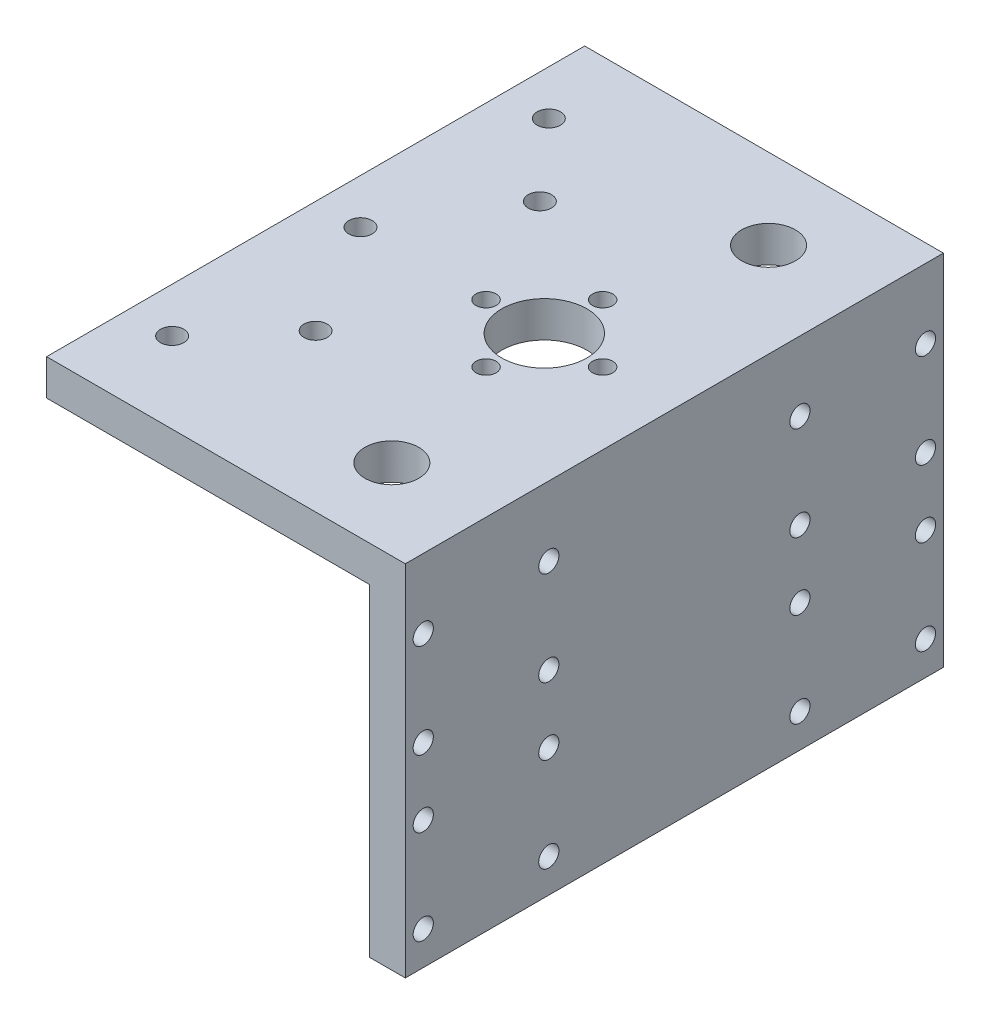
from build123d import *

# Parameters (mm, degrees)
ESTRUSIONE_ESTRUSIONE1_DEPTH = 120
TAGLIO_ESTRUSIONE2_REACH     = 166.924
SCHIZZO6_R                   = 6
TAGLIO_ESTRUSIONE3_REACH     = 166.924
SCHIZZO7_R                   = 9.5
FORO_PER_VITE_M4_2_D         = 4.5
SCHIZZO12_R                  = 2.25
TAGLIO_ESTRUSIONE4_DEPTH     = 10
SCHIZZO14_R                  = 2.6
TAGLIO_ESTRUSIONE5_DEPTH     = 10


with BuildPart() as part:
    # Schizzo1 → Estrusione-Estrusione1 (new body)
    with BuildSketch(Plane.XY):
        Polygon((0, 0), (-80, 0), (-80, -8), (-8, -8), (-8, -80), (0, -80), align=None)
    extrude(amount=ESTRUSIONE_ESTRUSIONE1_DEPTH)

    # Schizzo6 → Taglio-Estrusione2 (cut, up to next)
    with BuildSketch(Plane(origin=(0, 0, 0), x_dir=(1, 0, 0), z_dir=(0, 1, 0)), mode=Mode.PRIVATE) as taglio_estrusione2_sk1:
        with Locations((-21, -18)):
            Circle(SCHIZZO6_R)
    taglio_estrusione2_tool1 = extrude(taglio_estrusione2_sk1.sketch, amount=-TAGLIO_ESTRUSIONE2_REACH, mode=Mode.PRIVATE) & part.part
    # Schizzo6 → Taglio-Estrusione2 (cut, up to next)
    with BuildSketch(Plane(origin=(0, 0, 0), x_dir=(1, 0, 0), z_dir=(0, 1, 0)), mode=Mode.PRIVATE) as taglio_estrusione2_sk2:
        with Locations((-21, -102)):
            Circle(SCHIZZO6_R)
    taglio_estrusione2_tool2 = extrude(taglio_estrusione2_sk2.sketch, amount=-TAGLIO_ESTRUSIONE2_REACH, mode=Mode.PRIVATE) & part.part
    add(taglio_estrusione2_tool1.solids().sort_by_distance((-21, 0, 18))[0], mode=Mode.SUBTRACT)
    add(taglio_estrusione2_tool2.solids().sort_by_distance((-21, 0, 102))[0], mode=Mode.SUBTRACT)

    # Schizzo7 → Taglio-Estrusione3 (cut, up to next)
    with BuildSketch(Plane(origin=(0, 0, 0), x_dir=(1, 0, 0), z_dir=(0, 1, 0)), mode=Mode.PRIVATE) as taglio_estrusione3_sk1:
        with Locations((-29, -60)):
            Circle(SCHIZZO7_R)
    taglio_estrusione3_tool1 = extrude(taglio_estrusione3_sk1.sketch, amount=-TAGLIO_ESTRUSIONE3_REACH, mode=Mode.PRIVATE) & part.part
    add(taglio_estrusione3_tool1.solids().sort_by_distance((-29, 0, 60))[0], mode=Mode.SUBTRACT)

    # Foro per Vite M4-2 (through all)
    with Locations(Plane(origin=(0, 0, 0), x_dir=(1, 0, 0), z_dir=(0, 1, 0))):
        with Locations((-29, -47), (-42, -60), (-29, -73), (-16, -60), (-29, -60)):
            Hole(FORO_PER_VITE_M4_2_D / 2)

    # Schizzo12 → Taglio-Estrusione4 (cut)
    with BuildSketch(Plane(origin=(0, 0, 0), x_dir=(0, 0, -1), z_dir=(1, 0, 0))):
        with Locations((-116, -15.5)):
            Circle(SCHIZZO12_R)
        with Locations((-88, -15.5)):
            Circle(SCHIZZO12_R)
        with Locations((-88, -36.5)):
            Circle(SCHIZZO12_R)
        with Locations((-116, -36.5)):
            Circle(SCHIZZO12_R)
        with Locations((-32, -36.5)):
            Circle(SCHIZZO12_R)
        with Locations((-4, -36.5)):
            Circle(SCHIZZO12_R)
        with Locations((-32, -15.5)):
            Circle(SCHIZZO12_R)
        with Locations((-4, -15.5)):
            Circle(SCHIZZO12_R)
        with Locations((-116, -51.5)):
            Circle(SCHIZZO12_R)
        with Locations((-88, -51.5)):
            Circle(SCHIZZO12_R)
        with Locations((-88, -72.5)):
            Circle(SCHIZZO12_R)
        with Locations((-116, -72.5)):
            Circle(SCHIZZO12_R)
        with Locations((-4, -72.5)):
            Circle(SCHIZZO12_R)
        with Locations((-32, -72.5)):
            Circle(SCHIZZO12_R)
        with Locations((-32, -51.5)):
            Circle(SCHIZZO12_R)
        with Locations((-4, -51.5)):
            Circle(SCHIZZO12_R)
    extrude(amount=-TAGLIO_ESTRUSIONE4_DEPTH, mode=Mode.SUBTRACT)

    # Schizzo14 → Taglio-Estrusione5 (cut)
    with BuildSketch(Plane(origin=(0, 0, 0), x_dir=(1, 0, 0), z_dir=(0, 1, 0))):
        with Locations((-70, -18)):
            Circle(SCHIZZO14_R)
        with Locations((-70, -60)):
            Circle(SCHIZZO14_R)
        with Locations((-70, -102)):
            Circle(SCHIZZO14_R)
        with Locations((-55, -35)):
            Circle(SCHIZZO14_R)
        with Locations((-55, -85)):
            Circle(SCHIZZO14_R)
    extrude(amount=-TAGLIO_ESTRUSIONE5_DEPTH, mode=Mode.SUBTRACT)


solid = part.part
